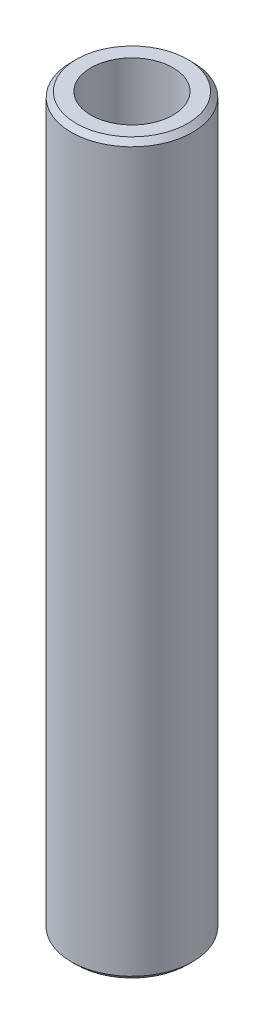
from build123d import *

# Parameters (mm, degrees)
SKETCH1_R           = 50
BOSS_EXTRUDE1_DEPTH = 600
SKETCH2_R           = 33.840707908
CUT_EXTRUDE1_DEPTH  = 605.15229868
CHAMFER1_SIZE       = 4.175170169


with BuildPart() as part:
    # Sketch1 → Boss-Extrude1 (new body)
    with BuildSketch(Plane(origin=(0, 0, 0), x_dir=(1, 0, 0), z_dir=(0, 1, 0))):
        Circle(SKETCH1_R)
    extrude(amount=BOSS_EXTRUDE1_DEPTH)

    # Sketch2 → Cut-Extrude1 (cut, through all)
    with BuildSketch(Plane(origin=(0, 0, 0), x_dir=(1, 0, 0), z_dir=(0, 1, 0))):
        Circle(SKETCH2_R)
    extrude(amount=CUT_EXTRUDE1_DEPTH, mode=Mode.SUBTRACT)

    # Chamfer1
    chamfer1_edges = [part.edges().sort_by_distance(p)[0] for p in [
        (-50, 600, 0),
        (-50, 0, 0),
    ]]
    chamfer(chamfer1_edges, length=CHAMFER1_SIZE)


solid = part.part
